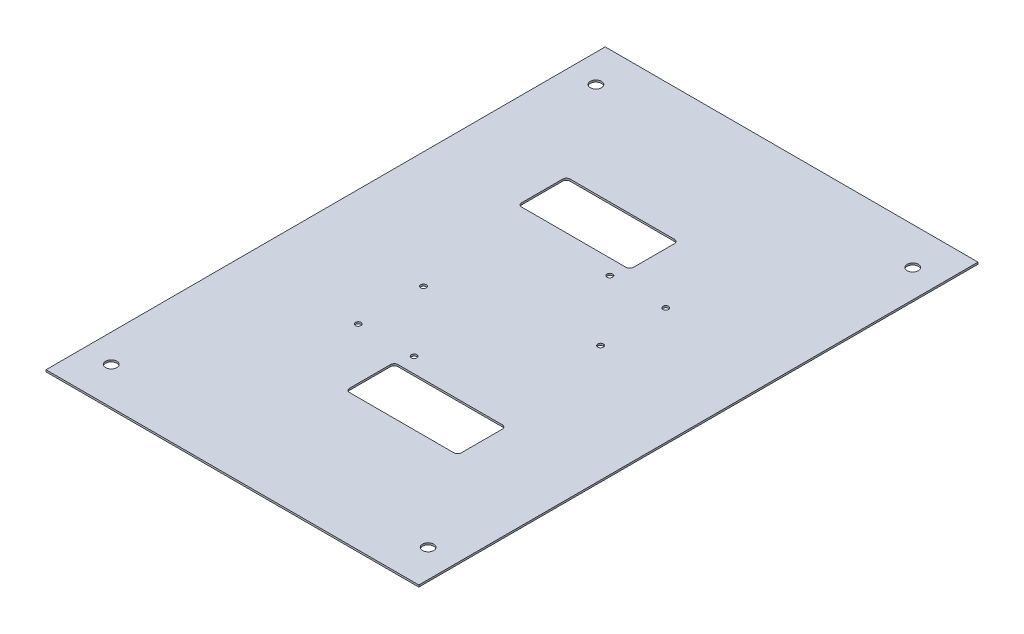
from build123d import *

# Parameters (mm, degrees)
ESQUISSE1_W        = 200
ESQUISSE1_H        = 300
ESQUISSE1_R        = 1.5
ESQUISSE1_R_2      = 3
BOSS_EXTRU_1_DEPTH = 1


with BuildPart() as part:
    # Esquisse1 → Boss.-Extru.1 (new body)
    with BuildSketch(Plane(origin=(0, 0, 0), x_dir=(1, 0, 0), z_dir=(0, 1, 0))):
        Rectangle(ESQUISSE1_W, ESQUISSE1_H)
        with Locations((-37.5, -45)):
            Circle(ESQUISSE1_R, mode=Mode.SUBTRACT)
        with Locations((-7.5, -45)):
            Circle(ESQUISSE1_R, mode=Mode.SUBTRACT)
        with Locations((-37.5, -10)):
            Circle(ESQUISSE1_R, mode=Mode.SUBTRACT)
        with Locations((37.5, 10)):
            Circle(ESQUISSE1_R, mode=Mode.SUBTRACT)
        with Locations((37.5, 45)):
            Circle(ESQUISSE1_R, mode=Mode.SUBTRACT)
        with Locations((7.5, 45)):
            Circle(ESQUISSE1_R, mode=Mode.SUBTRACT)
        with Locations((85, 130)):
            Circle(ESQUISSE1_R_2, mode=Mode.SUBTRACT)
        with Locations((-85, 130)):
            Circle(ESQUISSE1_R_2, mode=Mode.SUBTRACT)
        with Locations((85, -130)):
            Circle(ESQUISSE1_R_2, mode=Mode.SUBTRACT)
        with Locations((-85, -130)):
            Circle(ESQUISSE1_R_2, mode=Mode.SUBTRACT)
        with BuildLine():
            Line((-8, -53.175), (48, -53.175))
            ThreePointArc((48, -53.175), (49.414213562, -53.760786438), (50, -55.175))
            Line((50, -55.175), (50, -77.175))
            ThreePointArc((50, -77.175), (49.414213562, -78.589213562), (48, -79.175))
            Line((48, -79.175), (-8, -79.175))
            ThreePointArc((-8, -79.175), (-9.414213562, -78.589213562), (-10, -77.175))
            Line((-10, -77.175), (-10, -55.175))
            ThreePointArc((-10, -55.175), (-9.414213562, -53.760786438), (-8, -53.175))
        make_face(mode=Mode.SUBTRACT)
        with BuildLine():
            Line((-48, 79.175), (8, 79.175))
            ThreePointArc((8, 79.175), (9.414213562, 78.589213562), (10, 77.175))
            Line((10, 77.175), (10, 55.175))
            ThreePointArc((10, 55.175), (9.414213562, 53.760786438), (8, 53.175))
            Line((8, 53.175), (-48, 53.175))
            ThreePointArc((-48, 53.175), (-49.414213562, 53.760786438), (-50, 55.175))
            Line((-50, 55.175), (-50, 77.175))
            ThreePointArc((-50, 77.175), (-49.414213562, 78.589213562), (-48, 79.175))
        make_face(mode=Mode.SUBTRACT)
    extrude(amount=BOSS_EXTRU_1_DEPTH)


solid = part.part
